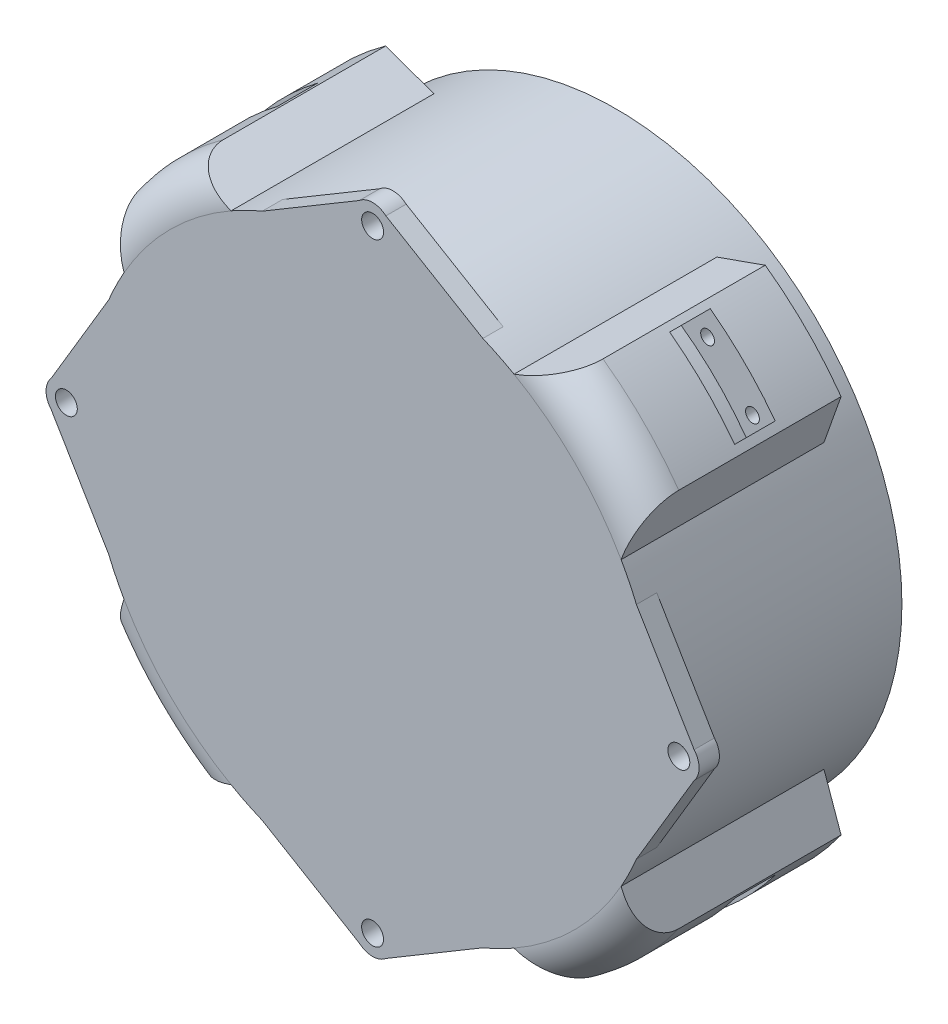
from build123d import *

# Parameters (mm, degrees)
BOSS_EXTRUDE1_DEPTH      = 30.4
SKETCH3_W                = 77
SKETCH3_H                = 41
BOSS_EXTRUDE2_DEPTH      = 5
SKETCH4_W                = 6
SKETCH4_H                = 16
CUT_EXTRUDE1_DEPTH       = 24
SKETCH6_R                = 65.5
BOSS_EXTRUDE3_DEPTH      = 5
SKETCH7_R                = 70.5
SKETCH7_R_2              = 65.5
BOSS_EXTRUDE4_DEPTH      = 60
BOSS_EXTRUDE5_DEPTH      = 56
SKETCH17_W               = 6
SKETCH17_H               = 16
CUT_EXTRUDE7_DEPTH       = 64
SKETCH19_R               = 1.7
CUT_EXTRUDE8_DEPTH       = 11
FILLET1_R                = 2
SKETCH20_W               = 20.402949817
SKETCH20_H               = 4.4
SKETCH20_W_2             = 8.662229964
CUT_EXTRUDE9_DEPTH       = 10
FILLET2_R                = 2
BOSS_EXTRUDE6_DEPTH      = 56
SKETCH23_R               = 1.7
CUT_EXTRUDE10_DEPTH      = 10
FILLET3_R                = 2
SKETCH25_W               = 4.4
SKETCH25_H               = 10.19489783
SKETCH25_W_2             = 2.2
SKETCH25_H_2             = 7.459952123
CUT_EXTRUDE11_DEPTH      = 10
SKETCH28_R               = 1.7
BOSS_EXTRUDE7_DEPTH      = 5
SKETCH30_R               = 2.7
BOSS_EXTRUDE8_DEPTH      = 5
BOSS_EXTRUDE9_DEPTH      = 55
BOSS_EXTRUDE9_DEPTH_BACK = 5
FILLET4_R                = 10
CUT_EXTRUDE12_START      = -10
SKETCH32_R               = 80.5
SKETCH32_R_2             = 70.5
CUT_EXTRUDE12_DEPTH      = 10
SKETCH33_R               = 1.7
CUT_EXTRUDE13_DEPTH      = 20
CUT_EXTRUDE14_DEPTH      = 5
CUT_EXTRUDE14_DEPTH_BACK = 5


with BuildPart() as part:
    # Sketch2 → Boss-Extrude1 (new body)
    with BuildSketch(Plane.XY):
        Polygon((-38.5, 15.5), (-38.5, -15.5), (-38.5, -20.5), (38.5, -20.5), (38.5, -15.5), (38.5, 15.5), (38.5, 20.5), (33.5, 20.5), (-33.5, 20.5), (-38.5, 20.5), align=None)
        Polygon((-33.5, -15.5), (-33.5, 15.5), (33.5, 15.5), (33.5, -15.5), (0, -15.5), align=None, mode=Mode.SUBTRACT)
    extrude(amount=-BOSS_EXTRUDE1_DEPTH)

    # Sketch3 → Boss-Extrude2 (add)
    with BuildSketch(Plane.XY):
        Rectangle(SKETCH3_W, SKETCH3_H)
    extrude(amount=BOSS_EXTRUDE2_DEPTH)

    # Sketch4 → Cut-Extrude1 (cut)
    with BuildSketch(Plane.ZY.offset(38.5)):
        with Locations((-7, 0)):
            Rectangle(SKETCH4_W, SKETCH4_H)
    extrude(amount=-CUT_EXTRUDE1_DEPTH, mode=Mode.SUBTRACT)

    # Sketch6 → Boss-Extrude3 (add)
    with BuildSketch(Plane.XY.offset(5)):
        with Locations((-19.5, 0)):
            Circle(SKETCH6_R)
    extrude(amount=-BOSS_EXTRUDE3_DEPTH)

    # Sketch7 → Boss-Extrude4 (add)
    with BuildSketch(Plane.XY.offset(5)):
        with Locations((-19.5, 0)):
            Circle(SKETCH7_R)
        with Locations((-19.5, 0)):
            Circle(SKETCH7_R_2, mode=Mode.SUBTRACT)
    extrude(amount=-BOSS_EXTRUDE4_DEPTH)

    # Sketch8 → Boss-Extrude5 (add)
    with BuildSketch(Plane(origin=(0, 0, 0), x_dir=(-1, 0, 0), z_dir=(0, 0, -1))):
        Polygon((9.5, -45.5), (19.5, -45.5), (19.969592872, -45.5), (29.5, -45.5), (29.5, -35.5), (9.5, -35.5), align=None)
    boss_extrude5 = extrude(amount=BOSS_EXTRUDE5_DEPTH)

    # Sketch17 → Cut-Extrude7 (cut)
    with BuildSketch(Plane.ZY.offset(38.5)):
        with Locations((-7, 0)):
            Rectangle(SKETCH17_W, SKETCH17_H)
    extrude(amount=CUT_EXTRUDE7_DEPTH, mode=Mode.SUBTRACT)

    # Sketch19 → Cut-Extrude8 (cut)
    with BuildSketch(Plane(origin=(0, -45.5, 0), x_dir=(-1, 0, 0), z_dir=(0, -1, 0))):
        with Locations(Location((19.5, 52.8, 0), (0, 0, 90))):
            Circle(SKETCH19_R)
        Polygon((29.5, 56), (25.7, 56), (29.5, 0), align=None)
        Polygon((9.5, 0), (13.3, 56), (9.5, 56), align=None)
    cut_extrude8 = extrude(amount=-CUT_EXTRUDE8_DEPTH, mode=Mode.SUBTRACT)

    # Fillet1
    fillet1_edges = [part.edges().sort_by_distance(p)[0] for p in [
        (-25.7, -40.5, -56),
        (-13.3, -40.5, -56),
    ]]
    fillet(fillet1_edges, radius=FILLET1_R)

    # Sketch20 → Cut-Extrude9 (cut)
    with BuildSketch(Plane(origin=(0, 0, -56), x_dir=(-1, 0, 0), z_dir=(0, 0, -1))):
        with Locations((34.032589891, -40.5)):
            Rectangle(SKETCH20_W, SKETCH20_H)
        Polygon((13.173473769, -42.7), (13.173473769, -40.5), (13.173473769, -38.3), (3.318050075, -38.3), (3.318050075, -42.7), align=None)
        with Locations((19.5, -40.5)):
            Rectangle(SKETCH20_W_2, SKETCH20_H)
        Polygon((13.173473769, -38.3), (13.173473769, -40.5), (13.173473769, -42.7), (15.168885018, -42.7), (15.168885018, -38.3), align=None)
    cut_extrude9 = extrude(amount=-CUT_EXTRUDE9_DEPTH, mode=Mode.SUBTRACT)

    # Mirror1: Boss-Extrude5, Cut-Extrude8, Cut-Extrude9 across plane
    add(boss_extrude5.mirror(Plane(origin=(0, 0, 0), x_dir=(0, 0, 1), z_dir=(0, -1, 0))))
    add(cut_extrude8.mirror(Plane(origin=(0, 0, 0), x_dir=(0, 0, 1), z_dir=(0, -1, 0))), mode=Mode.SUBTRACT)
    add(cut_extrude9.mirror(Plane(origin=(0, 0, 0), x_dir=(0, 0, 1), z_dir=(0, -1, 0))), mode=Mode.SUBTRACT)

    # Fillet2
    fillet2_edges = [part.edges().sort_by_distance(p)[0] for p in [
        (-25.7, 36.9, -56),
        (-13.3, 36.9, -56),
        (-13.3, 44.1, -56),
        (-25.7, 44.1, -56),
    ]]
    fillet(fillet2_edges, radius=FILLET2_R)

    # Sketch22 → Boss-Extrude6 (add)
    with BuildSketch(Plane(origin=(0, 0, 0), x_dir=(-1, 0, 0), z_dir=(0, 0, -1))):
        Polygon((65, 11.124908314), (65, 0), (65, -10), (55, -10), (55, 11.124908314), align=None)
    extrude(amount=BOSS_EXTRUDE6_DEPTH)

    # Sketch23 → Cut-Extrude10 (cut)
    with BuildSketch(Plane.ZY.offset(65)):
        with Locations((-52.8, 0)):
            Circle(SKETCH23_R)
        Polygon((-56, -10), (-56, -6.2), (0, -10), (-55.457400856, -10), align=None)
        Polygon((-56, 11.124908314), (-56, 6.762454157), (0.523867722, 11.124908314), align=None)
    extrude(amount=-CUT_EXTRUDE10_DEPTH, mode=Mode.SUBTRACT)

    # Fillet3
    fillet3_edges = [part.edges().sort_by_distance(p)[0] for p in [
        (-60, 6.762454157, -56),
        (-60, -6.2, -56),
    ]]
    fillet(fillet3_edges, radius=FILLET3_R)

    # Sketch25 → Cut-Extrude11 (cut)
    with BuildSketch(Plane(origin=(0, 0, -56), x_dir=(-1, 0, 0), z_dir=(0, 0, -1))):
        with Locations((60, 10.008313271)):
            Rectangle(SKETCH25_W, SKETCH25_H)
        Polygon((57.8, -4.331114982), (60, -4.331114982), (62.2, -4.331114982), (62.2, 4.910864356), (57.8, 4.910864356), align=None)
        with Locations((61.1, -8.061091044)):
            Rectangle(SKETCH25_W_2, SKETCH25_H_2)
        with Locations((58.9, -8.061091044)):
            Rectangle(SKETCH25_W_2, SKETCH25_H_2)
    extrude(amount=-CUT_EXTRUDE11_DEPTH, mode=Mode.SUBTRACT)

    # Sketch28 → Boss-Extrude7 (add)
    # profile 1 of 2: a face of its own
    with BuildSketch(Plane(origin=(0, 0, -30.4), x_dir=(-1, 0, 0), z_dir=(0, 0, -1))):
        with BuildLine():
            ThreePointArc((-3.688712639, -26.875410947), (0, -28.5), (3.688712639, -26.875410947))
            Line((3.688712639, -26.875410947), (9.52262653, -20.5))
            Line((9.52262653, -20.5), (-9.21080304, -20.5))
            Line((-9.21080304, -20.5), (-9.52262653, -20.5))
            Line((-9.52262653, -20.5), (-3.688712639, -26.875410947))
        make_face()
        with Locations((0, -23.5)):
            Circle(SKETCH28_R, mode=Mode.SUBTRACT)
    # profile 2 of 2: a face of its own
    with BuildSketch(Plane(origin=(0, 0, -30.4), x_dir=(-1, 0, 0), z_dir=(0, 0, -1))):
        with BuildLine():
            Line((-3.688712639, 26.875410947), (-9.52262653, 20.5))
            Line((-9.52262653, 20.5), (-9.21080304, 20.5))
            Line((-9.21080304, 20.5), (9.52262653, 20.5))
            Line((9.52262653, 20.5), (3.688712639, 26.875410947))
            ThreePointArc((3.688712639, 26.875410947), (0, 28.5), (-3.688712639, 26.875410947))
        make_face()
        with Locations((0, 23.5)):
            Circle(SKETCH28_R, mode=Mode.SUBTRACT)
    extrude(amount=-BOSS_EXTRUDE7_DEPTH)

    # Sketch30 → Boss-Extrude8 (add)
    # profile 1 of 4: a face of its own
    with BuildSketch(Plane.XY.offset(5)):
        with BuildLine():
            Line((-46.682122875, 65.049075289), (-22.783724725, 79.270563874))
            ThreePointArc((-22.783724725, 79.270563874), (-19.5, 80.5), (-16.216275275, 79.270563874))
            Line((-16.216275275, 79.270563874), (7.682122875, 65.049075289))
            ThreePointArc((7.682122875, 65.049075289), (-19.5, 70.5), (-46.682122875, 65.049075289))
        make_face()
        with Locations((-19.5, 75.5)):
            Circle(SKETCH30_R, mode=Mode.SUBTRACT)
    # profile 2 of 4: a face of its own
    with BuildSketch(Plane.XY.offset(5)):
        with BuildLine():
            Line((45.549075289, 27.182122875), (59.770563874, 3.283724725))
            ThreePointArc((59.770563874, 3.283724725), (61, 0), (59.770563874, -3.283724725))
            Line((59.770563874, -3.283724725), (45.549075289, -27.182122875))
            ThreePointArc((45.549075289, -27.182122875), (51, 0), (45.549075289, 27.182122875))
        make_face()
        with Locations((56, 0)):
            Circle(SKETCH30_R, mode=Mode.SUBTRACT)
    # profile 3 of 4: a face of its own
    with BuildSketch(Plane.XY.offset(5)):
        with BuildLine():
            Line((7.682122875, -65.049075289), (-16.216275275, -79.270563874))
            ThreePointArc((-16.216275275, -79.270563874), (-19.5, -80.5), (-22.783724725, -79.270563874))
            Line((-22.783724725, -79.270563874), (-46.682122875, -65.049075289))
            ThreePointArc((-46.682122875, -65.049075289), (-19.5, -70.5), (7.682122875, -65.049075289))
        make_face()
        with Locations((-19.5, -75.5)):
            Circle(SKETCH30_R, mode=Mode.SUBTRACT)
    # profile 4 of 4: a face of its own
    with BuildSketch(Plane.XY.offset(5)):
        with BuildLine():
            Line((-84.549075289, -27.182122875), (-98.770563874, -3.283724725))
            ThreePointArc((-98.770563874, -3.283724725), (-100, 0), (-98.770563874, 3.283724725))
            Line((-98.770563874, 3.283724725), (-84.549075289, 27.182122875))
            ThreePointArc((-84.549075289, 27.182122875), (-90, 0), (-84.549075289, -27.182122875))
        make_face()
        with Locations((-95, 0)):
            Circle(SKETCH30_R, mode=Mode.SUBTRACT)
    extrude(amount=-BOSS_EXTRUDE8_DEPTH)

    # Sketch31 → Boss-Extrude9 (add, two sides: drawn at the far end of the back side and taken through both)
    with BuildSketch(Plane(origin=(0, 0, 0), x_dir=(-1, 0, 0), z_dir=(0, 0, -1)).offset(-BOSS_EXTRUDE9_DEPTH_BACK)):
        with BuildLine():
            ThreePointArc((-15.372410577, -61.271241056), (-23.244831037, -56.063619395), (-30.351028074, -49.851028074))
            Line((-30.351028074, -49.851028074), (-37.422095886, -56.922095886))
            ThreePointArc((-37.422095886, -56.922095886), (-32.539382816, -61.417852747), (-27.302906206, -65.496091262))
            Line((-27.302906206, -65.496091262), (-15.372410577, -61.271241056))
        make_face()
        with BuildLine():
            Line((-37.422095886, -56.922095886), (-30.351028074, -49.851028074))
            ThreePointArc((-30.351028074, -49.851028074), (-36.563625344, -42.744823234), (-41.771250763, -34.872393522))
            Line((-41.771250763, -34.872393522), (-45.996091262, -46.802906206))
            ThreePointArc((-45.996091262, -46.802906206), (-41.917852747, -52.039382816), (-37.422095886, -56.922095886))
        make_face()
        with BuildLine():
            ThreePointArc((-41.771241056, 34.872410577), (-36.563619395, 42.744831037), (-30.351028074, 49.851028074))
            Line((-30.351028074, 49.851028074), (-37.422095886, 56.922095886))
            ThreePointArc((-37.422095886, 56.922095886), (-41.917852747, 52.039382816), (-45.996091262, 46.802906206))
            Line((-45.996091262, 46.802906206), (-41.771241056, 34.872410577))
        make_face()
        with BuildLine():
            Line((-37.422095886, 56.922095886), (-30.351028074, 49.851028074))
            ThreePointArc((-30.351028074, 49.851028074), (-23.244823234, 56.063625344), (-15.372393522, 61.271250763))
            Line((-15.372393522, 61.271250763), (-27.302906206, 65.496091263))
            ThreePointArc((-27.302906206, 65.496091263), (-32.539382816, 61.417852747), (-37.422095886, 56.922095886))
        make_face()
        with BuildLine():
            Line((76.422095886, 56.922095886), (69.351028074, 49.851028074))
            ThreePointArc((69.351028074, 49.851028074), (75.563625344, 42.744823234), (80.771250763, 34.872393522))
            Line((80.771250763, 34.872393522), (84.996091262, 46.802906206))
            ThreePointArc((84.996091262, 46.802906206), (80.917852747, 52.039382816), (76.422095886, 56.922095886))
        make_face()
        with BuildLine():
            ThreePointArc((54.372410577, 61.271241056), (62.244831037, 56.063619395), (69.351028074, 49.851028074))
            Line((69.351028074, 49.851028074), (76.422095886, 56.922095886))
            ThreePointArc((76.422095886, 56.922095886), (71.539382816, 61.417852747), (66.302906206, 65.496091263))
            Line((66.302906206, 65.496091263), (54.372410577, 61.271241056))
        make_face()
        with BuildLine():
            ThreePointArc((80.771241056, -34.872410577), (75.563619395, -42.744831037), (69.351028074, -49.851028074))
            Line((69.351028074, -49.851028074), (76.422095886, -56.922095886))
            ThreePointArc((76.422095886, -56.922095886), (80.917852747, -52.039382816), (84.996091262, -46.802906206))
            Line((84.996091262, -46.802906206), (80.771241056, -34.872410577))
        make_face()
        with BuildLine():
            Line((76.422095886, -56.922095886), (69.351028074, -49.851028074))
            ThreePointArc((69.351028074, -49.851028074), (62.244823234, -56.063625344), (54.372393522, -61.271250763))
            Line((54.372393522, -61.271250763), (66.302906206, -65.496091262))
            ThreePointArc((66.302906206, -65.496091262), (71.539382816, -61.417852747), (76.422095886, -56.922095886))
        make_face()
    extrude(amount=BOSS_EXTRUDE9_DEPTH + BOSS_EXTRUDE9_DEPTH_BACK)

    # Fillet4
    fillet4_edges = [part.edges().sort_by_distance(p)[0] for p in [
        (37.422095886, 56.922095886, -55),
        (37.422095886, 56.922095886, 5),
        (-76.422095886, 56.922095886, -55),
        (-76.422095886, 56.922095886, 5),
        (-76.422095886, -56.922095886, -55),
        (-76.422095886, -56.922095886, 5),
        (37.422095886, -56.922095886, -55),
        (37.422095886, -56.922095886, 5),
    ]]
    fillet(fillet4_edges, radius=FILLET4_R - 0.0001)  # a hair under: the kernel refuses the full size

    # Sketch32 → Cut-Extrude12 (cut)
    with BuildSketch(Plane(origin=(0, 0, -55), x_dir=(-1, 0, 0), z_dir=(0, 0, -1)).offset(CUT_EXTRUDE12_START)):
        with Locations((19.5, 0)):
            Circle(SKETCH32_R)
        with Locations(Location((19.5, 0, 0), (0, 0, 180))):
            Circle(SKETCH32_R_2, mode=Mode.SUBTRACT)
    extrude(amount=CUT_EXTRUDE12_DEPTH, mode=Mode.SUBTRACT)

    # Sketch33 → Cut-Extrude13 (cut)
    with BuildSketch(Plane(origin=(0, 0, -45), x_dir=(-1, 0, 0), z_dir=(0, 0, -1))):
        with Locations((-39.158598122, 46.910337234)):
            Circle(SKETCH33_R)
        with Locations((-28.083608747, 58.055274509)):
            Circle(SKETCH33_R)
        with Locations((66.410337234, 58.658598122)):
            Circle(SKETCH33_R)
        with Locations((77.555274509, 47.583608747)):
            Circle(SKETCH33_R)
        with Locations((78.158598122, -46.910337234)):
            Circle(SKETCH33_R)
        with Locations((67.083608747, -58.055274509)):
            Circle(SKETCH33_R)
        with Locations((-27.410337234, -58.658598122)):
            Circle(SKETCH33_R)
        with Locations((-38.555274509, -47.583608747)):
            Circle(SKETCH33_R)
    extrude(amount=-CUT_EXTRUDE13_DEPTH, mode=Mode.SUBTRACT)

    # Sketch35 → Cut-Extrude14 (cut, two sides: drawn at the far end of the back side and taken through both)
    with BuildSketch(Plane(origin=(0, 0, -25), x_dir=(-1, 0, 0), z_dir=(0, 0, -1)).offset(-CUT_EXTRUDE14_DEPTH_BACK)):
        with BuildLine():
            Line((-44.943541533, -48.241890041), (-40.476555829, -37.054861367))
            ThreePointArc((-40.476555829, -37.054861367), (-30.472031066, -49.729730656), (-17.845938242, -59.795743133))
            Line((-17.845938242, -59.795743133), (-28.977844015, -64.266232499))
            ThreePointArc((-28.977844015, -64.266232499), (-37.52635107, -56.817649403), (-44.943541533, -48.241890041))
        make_face()
        with BuildLine():
            Line((-28.741890041, 64.443541533), (-17.554861367, 59.976555829))
            ThreePointArc((-17.554861367, 59.976555829), (-30.229730656, 49.972031066), (-40.295743133, 37.345938242))
            Line((-40.295743133, 37.345938242), (-44.766232499, 48.477844015))
            ThreePointArc((-44.766232499, 48.477844015), (-37.317649403, 57.02635107), (-28.741890041, 64.443541533))
        make_face()
        with BuildLine():
            Line((83.943541533, 48.241890041), (79.476555829, 37.054861367))
            ThreePointArc((79.476555829, 37.054861367), (69.472031066, 49.729730656), (56.845938242, 59.795743133))
            Line((56.845938242, 59.795743133), (67.977844015, 64.266232499))
            ThreePointArc((67.977844015, 64.266232499), (76.52635107, 56.817649403), (83.943541533, 48.241890041))
        make_face()
        with BuildLine():
            Line((67.741890041, -64.443541533), (56.554861367, -59.976555829))
            ThreePointArc((56.554861367, -59.976555829), (69.229730656, -49.972031066), (79.295743133, -37.345938242))
            Line((79.295743133, -37.345938242), (83.766232499, -48.477844015))
            ThreePointArc((83.766232499, -48.477844015), (76.317649403, -57.02635107), (67.741890041, -64.443541533))
        make_face()
    extrude(amount=CUT_EXTRUDE14_DEPTH + CUT_EXTRUDE14_DEPTH_BACK, mode=Mode.SUBTRACT)


solid = part.part
